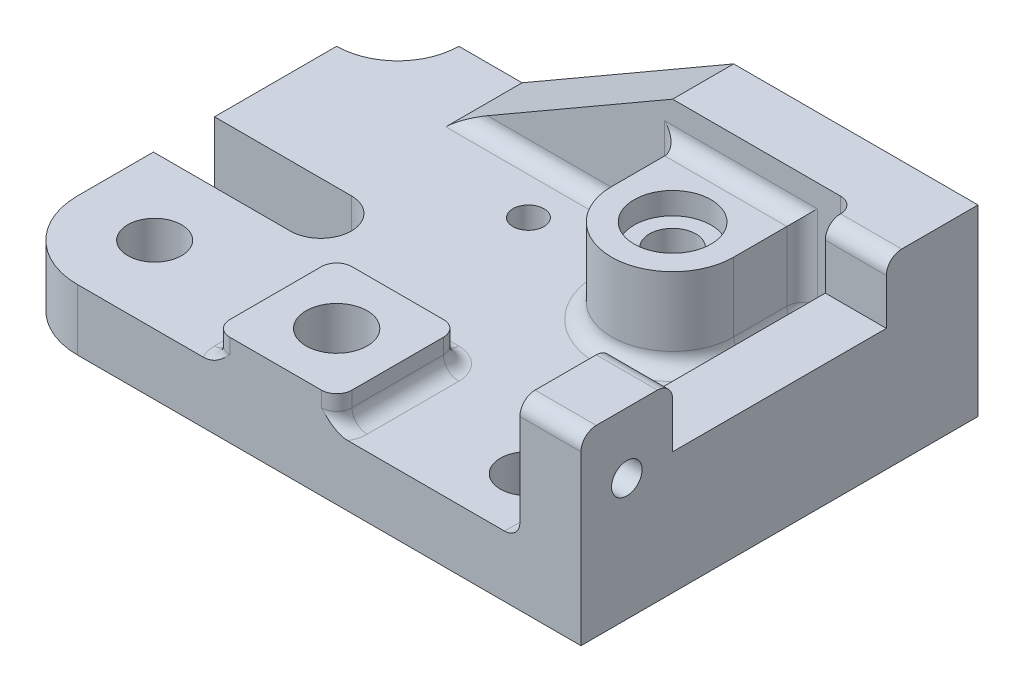
from build123d import *

# Parameters (mm, degrees)
SKETCH1_W           = 120.65
SKETCH1_H           = 82.55
BOSS_EXTRUDE1_DEPTH = 12.7
FILLET1_R           = 16.002
SKETCH2_R           = 5.588
SKETCH2_R_2         = 3.231202494
SKETCH2_R_3         = 6.35
CUT_EXTRUDE1_DEPTH  = 12.7
BOSS_EXTRUDE2_START = 6.35
SKETCH2_5_W         = 25.4
SKETCH2_5_H         = 25.4
SKETCH2_5_R         = 6.35
BOSS_EXTRUDE2_DEPTH = 6.35
BOSS_EXTRUDE3_DEPTH = 25.4
BOSS_EXTRUDE4_DEPTH = 17.526
BOSS_EXTRUDE5_DEPTH = 12.7
FILLET2_R           = 3.175
FILLET3_R           = 3.175
FILLET4_R           = 3.175
SKETCH5_R           = 8.001
CUT_EXTRUDE2_DEPTH  = 4.572
SKETCH6_R           = 4.826
CUT_EXTRUDE3_DEPTH  = 25.654
SKETCH7_W           = 44.45
SKETCH7_H           = 12.7
CUT_EXTRUDE4_DEPTH  = 12.7
FILLET5_R           = 3.175
FILLET6_R           = 3.175
SKETCH8_R           = 3.175
CUT_EXTRUDE5_DEPTH  = 12.7


with BuildPart() as part:
    # Sketch1 → Boss-Extrude1 (new body)
    with BuildSketch(Plane(origin=(0, 0, 0), x_dir=(1, 0, 0), z_dir=(0, 1, 0))):
        Rectangle(SKETCH1_W, SKETCH1_H)
    extrude(amount=BOSS_EXTRUDE1_DEPTH)

    # Fillet1
    fillet1_edges = [part.edges().sort_by_distance(p)[0] for p in [
        (-60.325, 6.35, 41.275),
    ]]
    fillet(fillet1_edges, radius=FILLET1_R)

    # Sketch2 → Cut-Extrude1 (cut)
    with BuildSketch(Plane(origin=(0, 12.7, 0), x_dir=(1, 0, 0), z_dir=(0, 1, 0))):
        with Locations(Location((36.449, -9.525, 0), (0, 0, 270))):
            Circle(SKETCH2_R)
        with Locations(Location((36.449, -28.575, 0), (0, 0, 270))):
            Circle(SKETCH2_R)
        with Locations(Location((-9.525, 17.653, 0), (0, 0, 270))):
            Circle(SKETCH2_R_2)
        with Locations(Location((-44.323, -25.273, 0), (0, 0, 270))):
            Circle(SKETCH2_R)
        with Locations(Location((-3.175, -28.575, 0), (0, 0, 270))):
            Circle(SKETCH2_R_3)
        with BuildLine():
            Line((-47.625, 41.275), (-60.325, 41.275))
            Line((-60.325, 41.275), (-60.325, 28.575))
            ThreePointArc((-60.325, 28.575), (-51.344743879, 32.294743879), (-47.625, 41.275))
        make_face()
        with BuildLine():
            Line((-60.325, 3.175), (-31.877, 3.175))
            ThreePointArc((-31.877, 3.175), (-25.527, -3.175), (-31.877, -9.525))
            Line((-31.877, -9.525), (-60.325, -9.525))
            Line((-60.325, -9.525), (-60.325, 3.175))
        make_face()
    extrude(amount=-CUT_EXTRUDE1_DEPTH, mode=Mode.SUBTRACT)

    # Sketch2<5> → Boss-Extrude2 (add)
    with BuildSketch(Plane(origin=(0, 12.7, 0), x_dir=(1, 0, 0), z_dir=(0, 1, 0)).offset(BOSS_EXTRUDE2_START)):
        with Locations((-3.175, -28.575)):
            Rectangle(SKETCH2_5_W, SKETCH2_5_H)
        with Locations(Location((-3.175, -28.575, 0), (0, 0, 270))):
            Circle(SKETCH2_5_R, mode=Mode.SUBTRACT)
    extrude(amount=-BOSS_EXTRUDE2_DEPTH)

    # Sketch2<6> → Boss-Extrude3 (add)
    with BuildSketch(Plane(origin=(0, 12.7, 0), x_dir=(1, 0, 0), z_dir=(0, 1, 0))):
        Polygon((60.325, -41.275), (60.325, 41.275), (9.525, 41.275), (9.525, 28.575), (47.625, 28.575), (47.625, -41.275), align=None)
    extrude(amount=BOSS_EXTRUDE3_DEPTH)

    # Sketch2<10> → Boss-Extrude4 (add)
    with BuildSketch(Plane(origin=(0, 12.7, 0), x_dir=(1, 0, 0), z_dir=(0, 1, 0))):
        with BuildLine():
            Line((11.049, 28.575), (11.049, 14.351))
            ThreePointArc((11.049, 14.351), (23.749, 1.651), (36.449, 14.351))
            Line((36.449, 14.351), (36.449, 28.575))
            Line((36.449, 28.575), (11.049, 28.575))
        make_face()
    extrude(amount=BOSS_EXTRUDE4_DEPTH)

    # Sketch4 → Boss-Extrude5 (add)
    with BuildSketch(Plane(origin=(0, 0, -41.275), x_dir=(-1, 0, 0), z_dir=(0, 0, -1))):
        Polygon((-9.525, 38.1), (-9.525, 12.7), (34.469090512, 12.7), align=None)
    extrude(amount=-BOSS_EXTRUDE5_DEPTH)

    # Fillet2
    fillet2_edges = [part.edges().sort_by_distance(p)[0] for p in [
        (42.037, 12.7, -28.575),
        (36.449, 21.463, -28.575),
        (11.049, 12.7, -21.463),
        (11.049, 21.463, -28.575),
        (23.749, 12.7, -1.651),
        (36.449, 12.7, -21.463),
        (23.749, 30.226, -28.575),
        (-11.710045256, 12.7, -28.575),
        (47.625, 12.7, 6.35),
        (47.625, 25.4, -28.575),
    ]]
    fillet(fillet2_edges, radius=FILLET2_R)

    # Fillet3
    fillet3_edges = [part.edges().sort_by_distance(p)[0] for p in [
        (9.525, 15.875, 15.875),
        (-15.875, 15.875, 15.875),
        (-15.875, 15.875, 41.275),
        (9.525, 15.875, 41.275),
    ]]
    fillet(fillet3_edges, radius=FILLET3_R)

    # Fillet4
    # the kernel refuses this fillet: 3.175 mm, written as the material it adds along each edge
    with BuildSketch(Plane(origin=(9.525, 12.7, 19.05), x_dir=(0, 1, 0), z_dir=(0, 0, 1)), Plane(origin=(-12.7, 12.7, 15.875), x_dir=(0, 1, 0), z_dir=(1, 0, 0)), Plane(origin=(-15.875, 12.7, 38.1), x_dir=(0, 1, 0), z_dir=(0, 0, -1))) as fillet4_piece_1:
        with BuildLine():
            CenterArc((FILLET4_R, -FILLET4_R), FILLET4_R, 90, 90)
            Line((0, -FILLET4_R), (0, 0))
            Line((0, 0), (FILLET4_R, 0))
        make_face()
    extrude(amount=19.05)
    with BuildSketch(Plane(origin=(6.35, 12.7, 38.1), x_dir=(-0.5976672776328281, 0, -0.8017442392976478), z_dir=(0.8017442392976478, 0, -0.5976672776328281))) as fillet4_piece_2_section:
        with BuildLine():
            CenterArc((3.175 + FILLET4_R, FILLET4_R), FILLET4_R, 180, 90)
            Line((3.175 + FILLET4_R, 0), (3.175, 0))
            Line((3.175, 0), (3.175, FILLET4_R))
        make_face()
    fillet4_piece_2 = revolve(axis=Axis((6.35, 12.7, 38.1), (0, 1, 0)), revolution_arc=233.296989237, mode=Mode.PRIVATE)
    fillet4_piece_2 = split(fillet4_piece_2, bisect_by=Plane(origin=(8.731056041, 13.689420087, 41.275), z_dir=(0, 0, -1)), keep=Keep.TOP, mode=Mode.PRIVATE)
    add(fillet4_piece_2)
    with BuildSketch(Plane(origin=(6.35, 12.7, 19.05), x_dir=(0, 0, -1), z_dir=(-1, 0, 0))) as fillet4_piece_3:
        with BuildLine():
            CenterArc((3.175 + FILLET4_R, -FILLET4_R), FILLET4_R, 90, 90)
            Line((3.175 + FILLET4_R, 0), (3.175, 0))
            Line((3.175, 0), (3.175, -FILLET4_R))
        make_face()
    revolve(axis=Axis((6.35, 12.7, 19.05), (0, -1, 0)), revolution_arc=90)
    with BuildSketch(Plane(origin=(-12.7, 12.7, 19.05), x_dir=(-1, 0, 0), z_dir=(0, 0, 1))) as fillet4_piece_4:
        with BuildLine():
            CenterArc((3.175 + FILLET4_R, -FILLET4_R), FILLET4_R, 90, 90)
            Line((3.175 + FILLET4_R, 0), (3.175, 0))
            Line((3.175, 0), (3.175, -FILLET4_R))
        make_face()
    revolve(axis=Axis((-12.7, 12.7, 19.05), (0, -1, 0)), revolution_arc=90)
    with BuildSketch(Plane(origin=(-12.7, 12.7, 38.1), x_dir=(0.5976672776328279, 0, -0.8017442392976479), z_dir=(-0.8017442392976479, 0, -0.5976672776328279))) as fillet4_piece_5_section:
        with BuildLine():
            CenterArc((3.175 + FILLET4_R, -FILLET4_R), FILLET4_R, 90, 90)
            Line((3.175, -FILLET4_R), (3.175, 0))
            Line((3.175, 0), (3.175 + FILLET4_R, 0))
        make_face()
    fillet4_piece_5 = revolve(axis=Axis((-12.7, 12.7, 38.1), (0, -1, 0)), revolution_arc=233.296989237, mode=Mode.PRIVATE)
    fillet4_piece_5 = split(fillet4_piece_5, bisect_by=Plane(origin=(-15.081056252, 13.689419911, 41.275), z_dir=(0, 0, -1)), keep=Keep.TOP, mode=Mode.PRIVATE)
    add(fillet4_piece_5)

    # Sketch5 → Cut-Extrude2 (cut)
    with BuildSketch(Plane(origin=(0, 30.226, 0), x_dir=(1, 0, 0), z_dir=(0, 1, 0))):
        with Locations(Location((23.749, 14.351, 0), (0, 0, 270))):
            Circle(SKETCH5_R)
    extrude(amount=-CUT_EXTRUDE2_DEPTH, mode=Mode.SUBTRACT)

    # Sketch6 → Cut-Extrude3 (cut)
    with BuildSketch(Plane(origin=(0, 25.654, 0), x_dir=(1, 0, 0), z_dir=(0, 1, 0))):
        with Locations(Location((23.749, 14.351, 0), (0, 0, 270))):
            Circle(SKETCH6_R)
    extrude(amount=-CUT_EXTRUDE3_DEPTH, mode=Mode.SUBTRACT)

    # Sketch7 → Cut-Extrude4 (cut)
    with BuildSketch(Plane(origin=(60.325, 0, 0), x_dir=(0, 0, -1), z_dir=(1, 0, 0))):
        with Locations((0, 31.75)):
            Rectangle(SKETCH7_W, SKETCH7_H)
    extrude(amount=-CUT_EXTRUDE4_DEPTH, mode=Mode.SUBTRACT)

    # Fillet5
    fillet5_edges = [part.edges().sort_by_distance(p)[0] for p in [
        (53.975, 38.1, -22.225),
    ]]
    fillet(fillet5_edges, radius=FILLET5_R)

    # Fillet6
    fillet6_edges = [part.edges().sort_by_distance(p)[0] for p in [
        (53.975, 38.1, 22.225),
        (53.975, 38.1, 41.275),
    ]]
    fillet(fillet6_edges, radius=FILLET6_R)

    # Sketch8 → Cut-Extrude5 (cut)
    with BuildSketch(Plane(origin=(60.325, 0, 0), x_dir=(0, 0, -1), z_dir=(1, 0, 0))):
        with Locations((-31.75, 25.4)):
            Circle(SKETCH8_R)
    extrude(amount=-CUT_EXTRUDE5_DEPTH, mode=Mode.SUBTRACT)


solid = part.part
